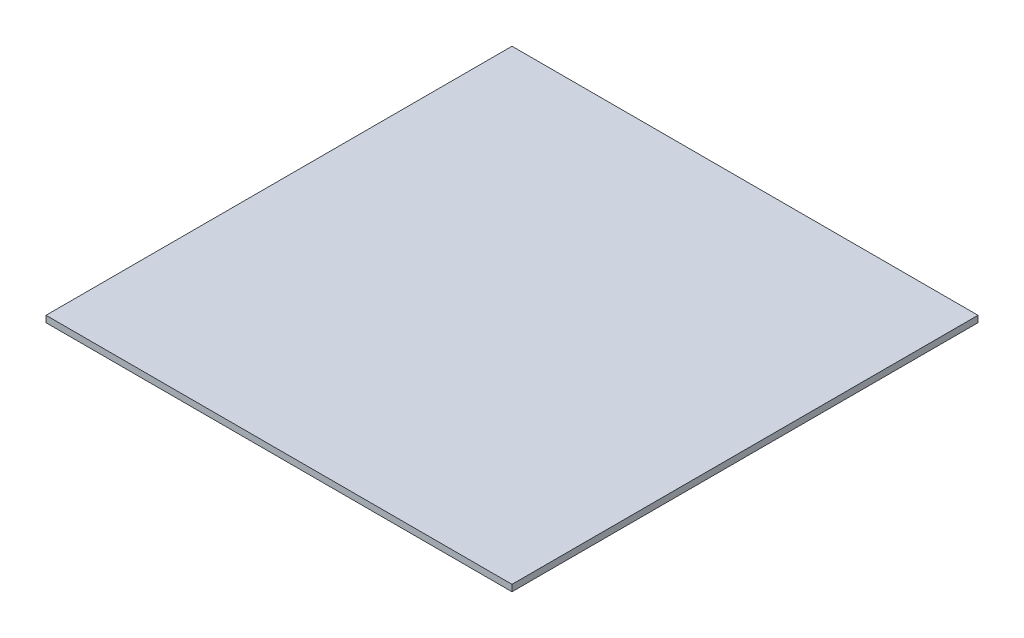
from build123d import *

# Parameters (mm, degrees)
SKETCH1_W           = 457.2
SKETCH1_H           = 457.2
BOSS_EXTRUDE1_DEPTH = 6.35


with BuildPart() as part:
    # Sketch1 → Boss-Extrude1 (new body)
    with BuildSketch(Plane(origin=(0, 0, 0), x_dir=(1, 0, 0), z_dir=(0, 1, 0))):
        with Locations((228.6, 228.6)):
            Rectangle(SKETCH1_W, SKETCH1_H)
    extrude(amount=BOSS_EXTRUDE1_DEPTH)


solid = part.part
